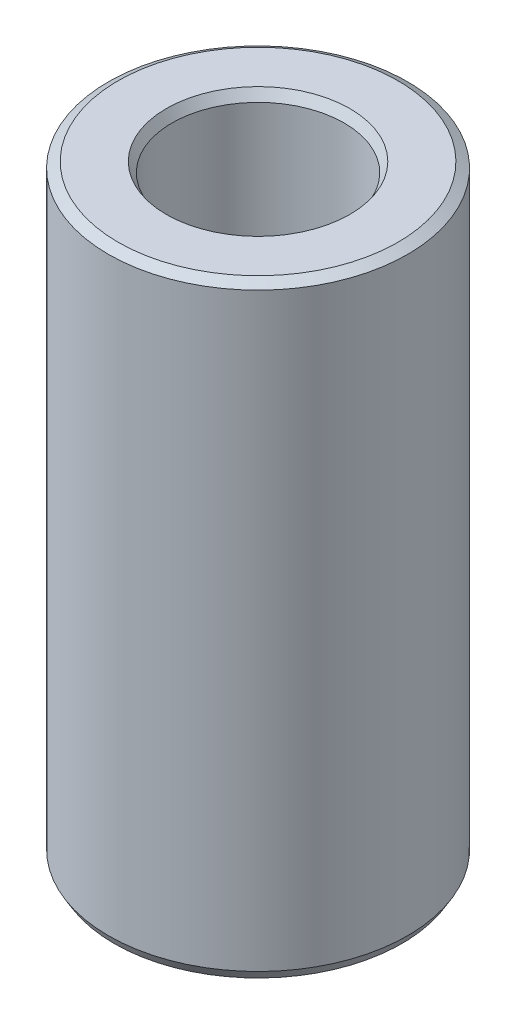
from build123d import *
from OCP.BRepFilletAPI import BRepFilletAPI_MakeChamfer

# Parameters (mm, degrees)
SKETCH1_R           = 20
BOSS_EXTRUDE1_DEPTH = 80.952996947
SKETCH2_R           = 11.511821624
CUT_EXTRUDE1_DEPTH  = 86.751896275
CHAMFER1_SIZE       = 0.759246635
CHAMFER1_SIZE2      = 1.290294631


with BuildPart() as part:
    # Sketch1 → Boss-Extrude1 (new body)
    with BuildSketch(Plane(origin=(0, 0, 0), x_dir=(1, 0, 0), z_dir=(0, 1, 0))):
        Circle(SKETCH1_R)
    extrude(amount=BOSS_EXTRUDE1_DEPTH)

    # Sketch2 → Cut-Extrude1 (cut, through all)
    with BuildSketch(Plane(origin=(0, 0, 0), x_dir=(1, 0, 0), z_dir=(0, 1, 0))):
        Circle(SKETCH2_R)
    extrude(amount=CUT_EXTRUDE1_DEPTH, mode=Mode.SUBTRACT)

    # Chamfer1: one chamfer whose edges measure the first distance from different faces: ONE call of the kernel's chamfer builder (chamfer() names one face for all edges)
    chamfer1_edges_1 = [part.edges().sort_by_distance(p)[0] for p in [
        (-11.511821624, 80.952996947, 0),
    ]]
    chamfer1_side_1 = [part.faces().sort_by_distance(p)[0] for p in [
        (-19.434314575, 80.952996947, 0),
    ]]
    chamfer1_edges_2 = [part.edges().sort_by_distance(p)[0] for p in [
        (-11.511821624, 0, 0),
    ]]
    chamfer1_side_2 = [part.faces().sort_by_distance(p)[0] for p in [
        (-11.511821624, 40.476498474, 0),
    ]]
    chamfer1_edges_3 = [part.edges().sort_by_distance(p)[0] for p in [
        (-20, 0, 0),
    ]]
    chamfer1_side_3 = [part.faces().sort_by_distance(p)[0] for p in [
        (-19.434314575, 0, 0),
    ]]
    chamfer1_edges_4 = [part.edges().sort_by_distance(p)[0] for p in [
        (-20, 80.952996947, 0),
    ]]
    chamfer1_side_4 = [part.faces().sort_by_distance(p)[0] for p in [
        (-20, 40.476498474, 0),
    ]]
    chamfer1 = BRepFilletAPI_MakeChamfer(part.part.solid().wrapped)
    for e in chamfer1_edges_1:
        chamfer1.Add(CHAMFER1_SIZE, CHAMFER1_SIZE2, e.wrapped, chamfer1_side_1[0].wrapped)  # the first distance lies on this face
    for e in chamfer1_edges_2:
        chamfer1.Add(CHAMFER1_SIZE, CHAMFER1_SIZE2, e.wrapped, chamfer1_side_2[0].wrapped)  # the first distance lies on this face
    for e in chamfer1_edges_3:
        chamfer1.Add(CHAMFER1_SIZE, CHAMFER1_SIZE2, e.wrapped, chamfer1_side_3[0].wrapped)  # the first distance lies on this face
    for e in chamfer1_edges_4:
        chamfer1.Add(CHAMFER1_SIZE, CHAMFER1_SIZE2, e.wrapped, chamfer1_side_4[0].wrapped)  # the first distance lies on this face
    add(Compound.cast(chamfer1.Shape()), mode=Mode.REPLACE)


solid = part.part
